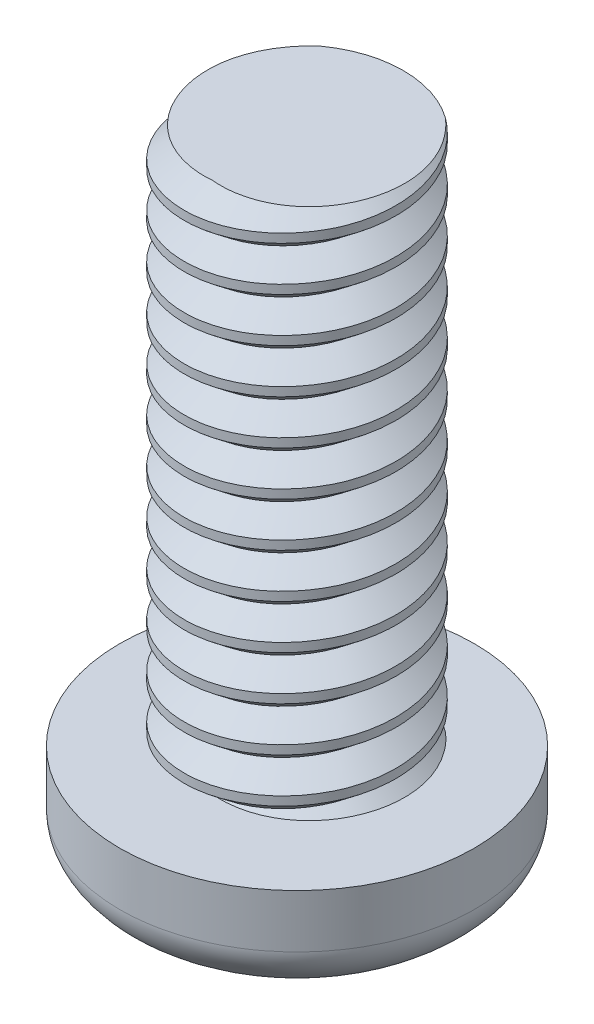
from build123d import *

# Parameters (mm, degrees)
SKETCH_1_R          = 1
EXTRUDE_1_DEPTH     = 0.7
SKETCH_2_R          = 0.6
EXTRUDE_2_DEPTH     = 3
CUT_EXTRUDE_2_DEPTH = 0.5
FILLET_2_SIZE       = 0.4
FILLET_2_SIZE_2     = 0.8
SWEEP_1_PITCH       = 0.25
SWEEP_1_TO          = 3


with BuildPart() as part:
    # 草图1 → 凸台-拉伸1 (new body)
    with BuildSketch(Plane(origin=(0, 0, 0), x_dir=(1, 0, 0), z_dir=(0, 1, 0))):
        with Locations(Location((0, 0, 0), (0, 0, 270))):
            Circle(SKETCH_1_R)
    extrude(amount=EXTRUDE_1_DEPTH)

    # 草图2 → 凸台-拉伸2 (add)
    with BuildSketch(Plane(origin=(0, 0.7, 0), x_dir=(1, 0, 0), z_dir=(0, 1, 0))):
        with Locations(Location((0, 0, 0), (0, 0, 270))):
            Circle(SKETCH_2_R)
    extrude(amount=EXTRUDE_2_DEPTH)

    # 草图3 → 切除-拉伸2 (cut)
    with BuildSketch(Plane(origin=(0, 0, 0), x_dir=(-1, 0, 0), z_dir=(0, -1, 0))):
        with BuildLine():
            Line((-0.15, 0.5), (-0.15, 0.15))
            Line((-0.15, 0.15), (-0.5, 0.15))
            ThreePointArc((-0.5, 0.15), (-0.65, 0), (-0.5, -0.15))
            Line((-0.5, -0.15), (-0.15, -0.15))
            Line((-0.15, -0.15), (-0.15, -0.5))
            ThreePointArc((-0.15, -0.5), (0, -0.65), (0.15, -0.5))
            Line((0.15, -0.5), (0.15, -0.15))
            Line((0.15, -0.15), (0.5, -0.15))
            ThreePointArc((0.5, -0.15), (0.65, 0), (0.5, 0.15))
            Line((0.5, 0.15), (0.15, 0.15))
            Line((0.15, 0.15), (0.15, 0.5))
            ThreePointArc((0.15, 0.5), (0, 0.65), (-0.15, 0.5))
        make_face()
    extrude(amount=-CUT_EXTRUDE_2_DEPTH, mode=Mode.SUBTRACT)

    # 圆角2
    # a fillet whose section is not a circle: 0.8, 0.4 mm, written as the material it takes off along each edge
    with BuildSketch(Plane(origin=(0, 0, 0), x_dir=(0, 0, 1), z_dir=(-1, 0, 0))) as fillet_2_piece_1:
        with BuildLine():
            Bezier((1, FILLET_2_SIZE), (1, 0), (1 - FILLET_2_SIZE_2, 0), weights=[1, 0.707106781, 1])
            Line((1 - FILLET_2_SIZE_2, 0), (1, 0))
            Line((1, 0), (1, FILLET_2_SIZE))
        make_face()
    revolve(axis=Axis((0, 0, 0), (0, 1, 0)), mode=Mode.SUBTRACT)

    # 切除-扫描1: arcs per turn and ends read off the stored shape
    # 切除-扫描1: the profile of 草图12 profile screwed along a right-hand helix through 13.666667 turns, 6 arcs to a turn; built about Z, then put on its axis
    sweep_1_z = Axis((0, 0, 0), (0, 0, 1))
    sweep_1_corners = [(0.6003, 0, -0.35024), (0.6003, 0, -0.14976), (0.475, 0, -0.25)]
    with BuildLine(mode=Mode.PRIVATE) as sweep_1_profile:
        Line(sweep_1_corners[0], sweep_1_corners[1])
        Line(sweep_1_corners[1], sweep_1_corners[2])
        Line(sweep_1_corners[2], sweep_1_corners[0])
    sweep_1_cap = Face(sweep_1_profile.wire())
    sweep_1_turn_angles = [0, 30, 60, 90, 120, 150, 180, 210, 240, 270, 300, 330, 360]
    sweep_1_turn_weights = [1, 0.8660254037844387, 1, 0.8660254037844387, 1, 0.8660254037844387, 1, 0.8660254037844387, 1, 0.8660254037844387, 1, 0.8660254037844387, 1]
    sweep_1_turn_rails = [Edge.make_bspline([Vector(p[0], p[1], 0).rotate(sweep_1_z, sweep_1_turn_angles[k]) / sweep_1_turn_weights[k] + Vector(0, 0, p[2] + SWEEP_1_PITCH * sweep_1_turn_angles[k] / 360) for k in range(13)], [0, 0, 0, 1, 1, 2, 2, 3, 3, 4, 4, 5, 5, 6, 6, 6], 2, sweep_1_turn_weights) for p in sweep_1_corners]
    sweep_1_turn_sides = [Face.make_surface_from_curves(sweep_1_turn_rails[p[0]], sweep_1_turn_rails[p[1]]) for p in [(0, 1), (1, 2), (2, 0)]]
    sweep_1_last_angles = [4680, 4710, 4740, 4770, 4800, 4830, 4860, 4890, 4920]
    sweep_1_last_weights = [1, 0.8660254037844387, 1, 0.8660254037844387, 1, 0.8660254037844387, 1, 0.8660254037844387, 1]
    sweep_1_last_rails = [Edge.make_bspline([Vector(p[0], p[1], 0).rotate(sweep_1_z, sweep_1_last_angles[k]) / sweep_1_last_weights[k] + Vector(0, 0, p[2] + SWEEP_1_PITCH * sweep_1_last_angles[k] / 360) for k in range(9)], [0, 0, 0, 1, 1, 2, 2, 3, 3, 4, 4, 4], 2, sweep_1_last_weights) for p in sweep_1_corners]
    sweep_1_last_sides = [Face.make_surface_from_curves(sweep_1_last_rails[p[0]], sweep_1_last_rails[p[1]]) for p in [(0, 1), (1, 2), (2, 0)]]
    sweep_1 = Plane(origin=(0, 3.7, 0), x_dir=(0, 0, 1), z_dir=(0, -1, 0)) * split(Solid(Shell([*[p.moved(Location((0, 0, SWEEP_1_PITCH * i))) for i in range(13) for p in sweep_1_turn_sides], *sweep_1_last_sides, sweep_1_cap, sweep_1_cap.rotate(sweep_1_z, 4920).moved(Location((0, 0, SWEEP_1_PITCH * 4920 / 360)))])), bisect_by=Plane.XY.offset(SWEEP_1_TO), keep=Keep.BOTTOM, mode=Mode.PRIVATE)
    add(sweep_1, mode=Mode.SUBTRACT)


solid = part.part
